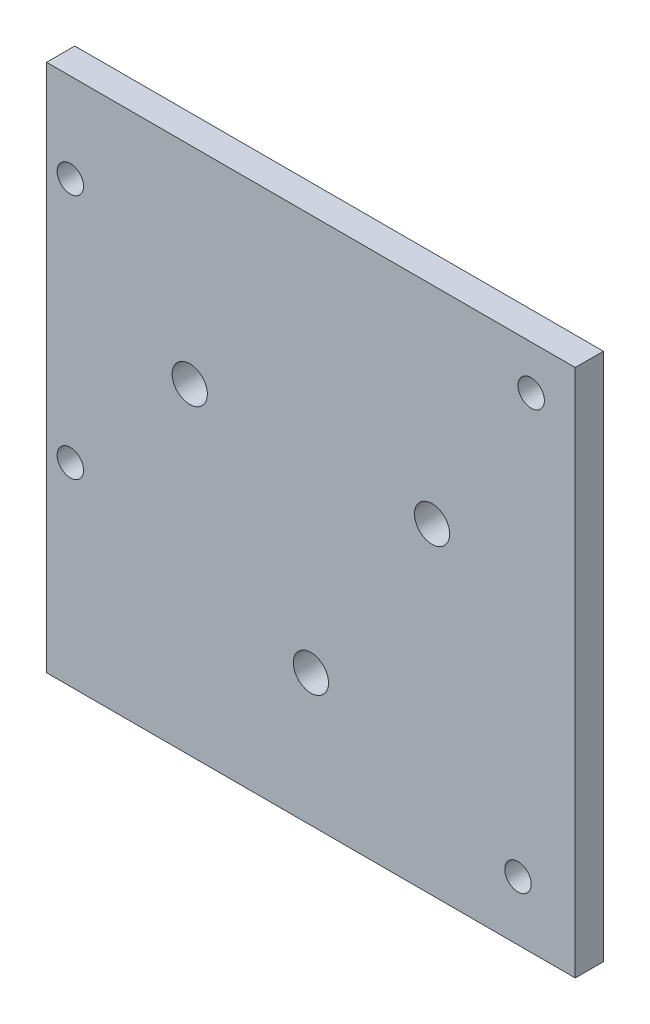
from build123d import *

# Parameters (mm, degrees)
SKETCH2_W           = 60
SKETCH2_H           = 60
BOSS_EXTRUDE2_DEPTH = 3.2
SKETCH3_R           = 1.5
ARDUINO_HOLES_DEPTH = 3.2
SKETCH5_R           = 2
CUT_EXTRUDE1_DEPTH  = 3.2


with BuildPart() as part:
    # Sketch2 → Boss-Extrude2 (new body)
    with BuildSketch(Plane.XY):
        with Locations((-2.549375328, 21.639166253)):
            Rectangle(SKETCH2_W, SKETCH2_H)
    extrude(amount=BOSS_EXTRUDE2_DEPTH)

    # Sketch3 → Arduino Holes (cut)
    with BuildSketch(Plane.XY.offset(3.2)):
        with Locations((20.950624672, -1.660833747)):
            Circle(SKETCH3_R)
        with Locations((22.450624672, 46.639166253)):
            Circle(SKETCH3_R)
        with Locations((-29.849375328, 13.639166253)):
            Circle(SKETCH3_R)
        with Locations((-29.849375328, 41.539166253)):
            Circle(SKETCH3_R)
    extrude(amount=-ARDUINO_HOLES_DEPTH, mode=Mode.SUBTRACT)

    # Sketch5 → Cut-Extrude1 (cut)
    with BuildSketch(Plane(origin=(0, 0, 0), x_dir=(-1, 0, 0), z_dir=(0, 0, -1))):
        with Locations((2.549375328, 6.639166253)):
            Circle(SKETCH5_R)
        with Locations((-11.200624672, 28.139166253)):
            Circle(SKETCH5_R)
        with Locations((16.299375328, 28.139166253)):
            Circle(SKETCH5_R)
    extrude(amount=-CUT_EXTRUDE1_DEPTH, mode=Mode.SUBTRACT)


solid = part.part
